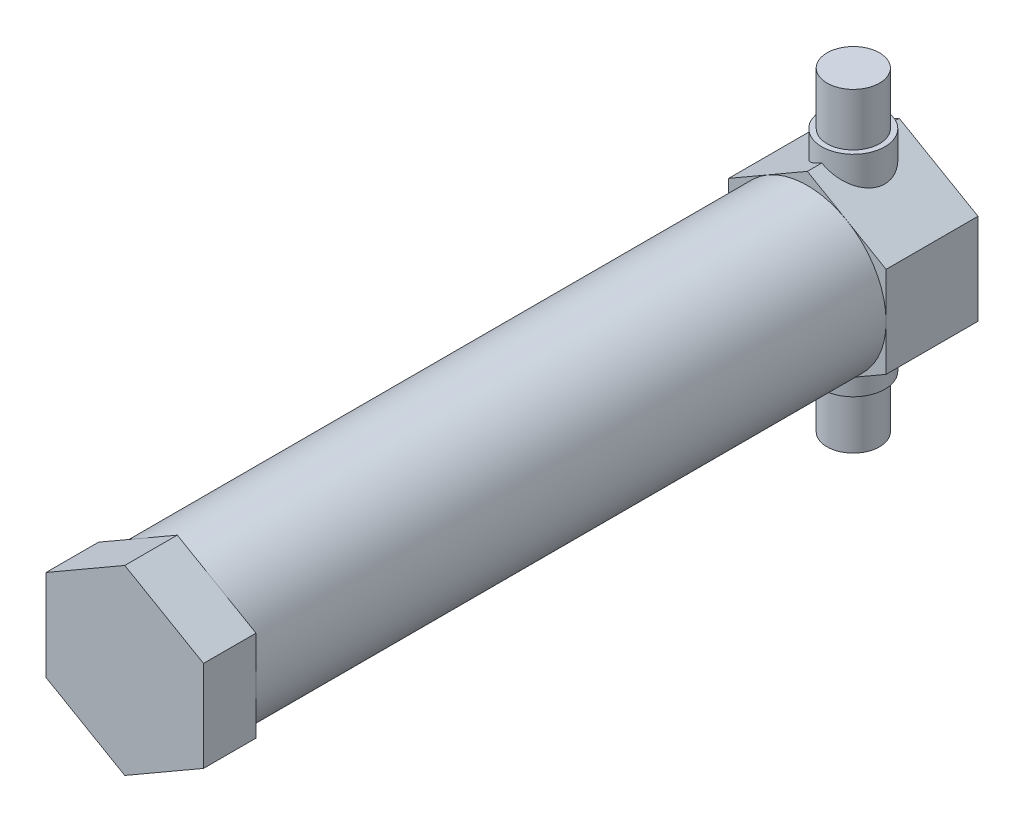
from build123d import *

# Parameters (mm, degrees)
SKETCH6_R           = 9.525
BOSS_EXTRUDE5_DEPTH = 93.6625
BOSS_EXTRUDE6_DEPTH = 6.35
BOSS_EXTRUDE7_DEPTH = 11.1125
SKETCH9_R           = 3.175
BOSS_EXTRUDE8_DEPTH = 19.05
SKETCH11_R          = 3.81
BOSS_EXTRUDE9_DEPTH = 12.7
SKETCH12_R          = 6.35
CUT_EXTRUDE2_DEPTH  = 50.8


with BuildPart() as part:
    # Sketch6 → Boss-Extrude5 (new body)
    with BuildSketch(Plane.XY):
        Circle(SKETCH6_R)
    extrude(amount=BOSS_EXTRUDE5_DEPTH)

    # Sketch7 → Boss-Extrude6 (add)
    with BuildSketch(Plane.XY.offset(93.6625)):
        Polygon((0, 10.998522628), (-9.525, 5.499261314), (-9.525, -5.499261314), (0, -10.998522628), (9.525, -5.499261314), (9.525, 5.499261314), align=None)
    extrude(amount=-BOSS_EXTRUDE6_DEPTH)

    # Sketch8 → Boss-Extrude7 (add)
    with BuildSketch(Plane(origin=(0, 0, 0), x_dir=(-1, 0, 0), z_dir=(0, 0, -1))):
        Polygon((0, 10.998522628), (-9.525, 5.499261314), (-9.525, -5.499261314), (0, -10.998522628), (9.525, -5.499261314), (9.525, 5.499261314), align=None)
    extrude(amount=-BOSS_EXTRUDE7_DEPTH)

    # Sketch9 → Boss-Extrude8 (add, symmetric)
    with BuildSketch(Plane(origin=(0, 0, 0), x_dir=(1, 0, 0), z_dir=(0, 1, 0))):
        with Locations((0, -5.55625)):
            Circle(SKETCH9_R)
    extrude(amount=BOSS_EXTRUDE8_DEPTH, both=True)

    # Sketch11 → Boss-Extrude9 (add, symmetric)
    with BuildSketch(Plane(origin=(0, 0, 0), x_dir=(1, 0, 0), z_dir=(0, 1, 0))):
        with Locations((0, -5.55625)):
            Circle(SKETCH11_R)
    extrude(amount=BOSS_EXTRUDE9_DEPTH, both=True)

    # Sketch12 → Cut-Extrude2 (cut)
    with BuildSketch(Plane(origin=(0, 0, 0), x_dir=(-1, 0, 0), z_dir=(0, 0, -1))):
        Circle(SKETCH12_R)
    extrude(amount=-CUT_EXTRUDE2_DEPTH, mode=Mode.SUBTRACT)


solid = part.part
